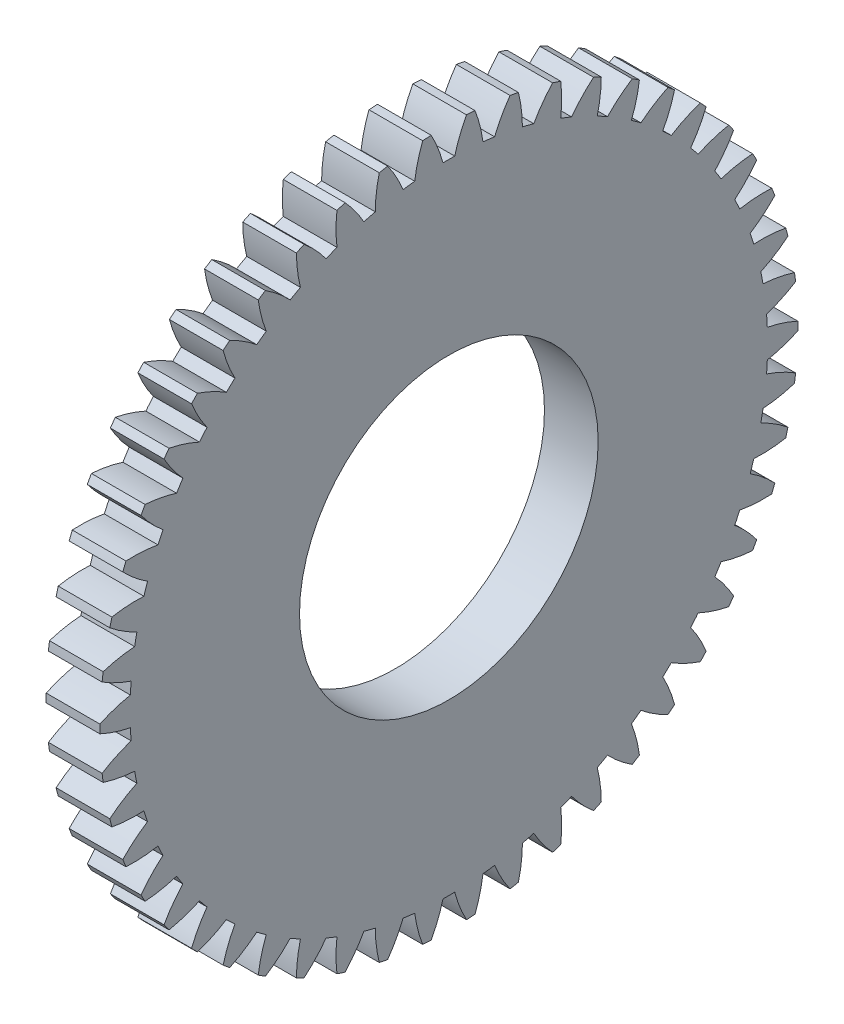
from build123d import *

# Parameters (mm, degrees)
BASPROSKE_W        = 4
BASPROSKE_H        = 26
TOOTHCUT_DEPTH     = 37.986484018
TEETHCUTS_COUNT    = 50
TEETHCUTS_ANGLE    = 352.8
BORSKE_R           = 2.5
BORE_DEPTH         = 50.0000508
CUT_EXTRUDE1_REACH = 38.963
SKETCH1_R          = 11.125


with BuildPart() as part:
    # BasProSke → Base-Revolve (revolve)
    with BuildSketch(Plane(origin=(0, 0, 0), x_dir=(1, 0, 0), z_dir=(0, 1, 0))):
        with Locations((2, 13)):
            Rectangle(BASPROSKE_W, BASPROSKE_H)
    revolve(axis=Axis((-10, 0, 0), (1, 0, 0)))

    # TooCutSke → ToothCut (cut, through all)
    with BuildSketch(Plane(origin=(0, 0, 0), x_dir=(0, 0, -1), z_dir=(1, 0, 0))):
        with BuildLine():
            ThreePointArc((0.437663408, 23.744966872), (0, 23.749), (-0.437663408, 23.744966872))
            ThreePointArc((-0.437663408, 23.744966872), (-0.815428123, 24.895236298), (-1.329433358, 25.991422664))
            ThreePointArc((-1.329433358, 25.991422664), (0, 26.0254), (1.329433358, 25.991422664))
            ThreePointArc((1.329433358, 25.991422664), (0.815428123, 24.895236298), (0.437663408, 23.744966872))
        make_face()
    toothcut = extrude(amount=TOOTHCUT_DEPTH, mode=Mode.SUBTRACT)

    # TeethCuts: ToothCut ×50 about axis
    teethcuts_axis = Axis((-10, 0, 0), (1, 0, 0))
    for i in range(1, TEETHCUTS_COUNT):
        add(toothcut.rotate(teethcuts_axis, i * TEETHCUTS_ANGLE / (TEETHCUTS_COUNT - 1)), mode=Mode.SUBTRACT)

    # BorSke → Bore (cut, symmetric)
    with BuildSketch(Plane(origin=(0, 0, 0), x_dir=(0, 0, -1), z_dir=(1, 0, 0))):
        Circle(BORSKE_R)
    extrude(amount=BORE_DEPTH, both=True, mode=Mode.SUBTRACT)

    # Sketch1 → Cut-Extrude1 (cut, up to next)
    with BuildSketch(Plane.ZY, mode=Mode.PRIVATE) as cut_extrude1_sk1:
        Circle(SKETCH1_R)
    cut_extrude1_tool1 = extrude(cut_extrude1_sk1.sketch, amount=-CUT_EXTRUDE1_REACH, mode=Mode.PRIVATE) & part.part
    add(cut_extrude1_tool1.solids().sort_by_distance((0, 0, 0))[0], mode=Mode.SUBTRACT)


solid = part.part
